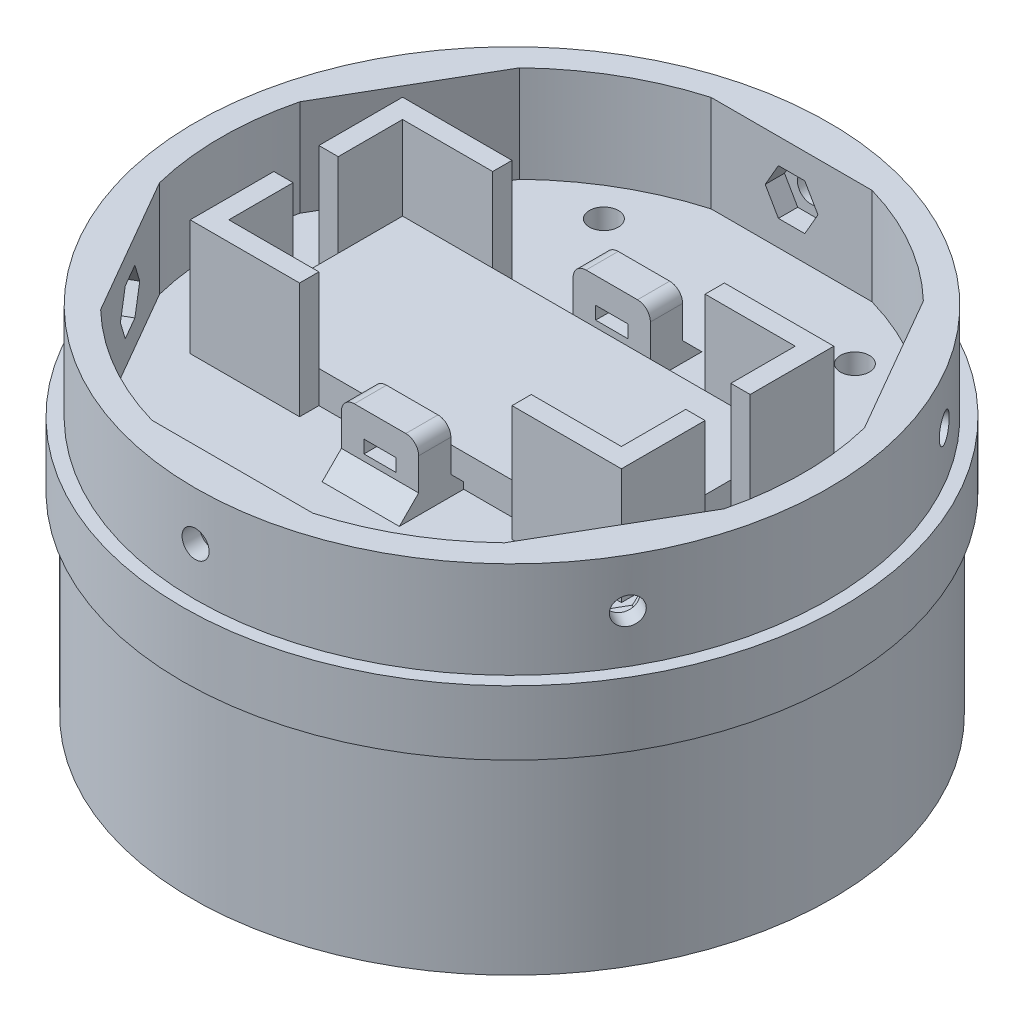
from build123d import *

# Parameters (mm, degrees)
SKETCH_5_R               = 49.2
EXTRUDE_3_DEPTH          = 15
SKETCH_9_R               = 2.25
CUT_EXTRUDE_3_DEPTH      = 56
EXTRUDE_4_DEPTH          = 18
SKETCH_4_W               = 61
SKETCH_4_H               = 27
EXTRUDE_5_DEPTH          = 5
SKETCH_11_W              = 12
SKETCH_11_H              = 5
EXTRUDE_6_DEPTH          = 10
FILLET_1_R               = 2
SKETCH_12_W              = 5
SKETCH_12_H              = 2
CUT_EXTRUDE_4_DEPTH      = 6
FILLET_1_OF_MIRROR_3_R   = 2
CHAMFER_5_SIZE           = 3
CUT_EXTRUDE_6_DEPTH      = 3
SKETCH_8_R               = 2.1
CUT_EXTRUDE_7_DEPTH      = 36
PATTERN_CIRCULAR_5_COUNT = 6
PATTERN_CIRCULAR_6_COUNT = 6
SKETCH_13_R              = 44.709478945
EXTRUDE_7_DEPTH          = 0.4
CHAMFER_6_SIZE           = 3


with BuildPart() as part:
    # Эскиз1 → Повернуть1 (revolve)
    with BuildSketch(Plane.XY, mode=Mode.PRIVATE) as revolve_1_sk:
        Polygon((44.7, 0), (49.7, 0), (49.7, 30), (51.2, 30), (51.2, 40), (0, 40), (0, 35), (44.7, 35), (44.7, 15), (32.7, 15), (32.7, 10), (44.7, 10), (44.7, 5), align=None)
    revolve(revolve_1_sk.sketch.rotate(Axis((0, 0, 0), (0, 1, 0)), 90), axis=Axis((0, 0, 0), (0, 1, 0)))

    # Эскиз5 → Бобышка-Вытянуть3 (add)
    with BuildSketch(Plane(origin=(0, 40, 0), x_dir=(1, 0, 0), z_dir=(0, 1, 0))):
        with Locations(Location((0, 0, 0), (0, 0, 270))):
            Circle(SKETCH_5_R)
        with BuildLine():
            ThreePointArc((-31.367715242, -32.543915568), (-22.6, -39.144348251), (-12.5, -43.437196042))
            Line((-12.5, -43.437196042), (12.5, -43.437196042))
            ThreePointArc((12.5, -43.437196042), (22.6, -39.144348251), (31.367715242, -32.543915568))
            Line((31.367715242, -32.543915568), (43.867715242, -10.893280474))
            ThreePointArc((43.867715242, -10.893280474), (45.2, 0), (43.867715242, 10.893280474))
            Line((43.867715242, 10.893280474), (31.367715242, 32.543915568))
            ThreePointArc((31.367715242, 32.543915568), (22.6, 39.144348251), (12.5, 43.437196042))
            Line((12.5, 43.437196042), (-12.5, 43.437196042))
            ThreePointArc((-12.5, 43.437196042), (-22.6, 39.144348251), (-31.367715242, 32.543915568))
            Line((-31.367715242, 32.543915568), (-43.867715242, 10.893280474))
            ThreePointArc((-43.867715242, 10.893280474), (-45.2, 0), (-43.867715242, -10.893280474))
            Line((-43.867715242, -10.893280474), (-31.367715242, -32.543915568))
        make_face(mode=Mode.SUBTRACT)
    extrude(amount=EXTRUDE_3_DEPTH)

    # Эскиз9 → Вырез-Вытянуть3 (cut)
    with BuildSketch(Plane.XZ):
        with Locations(Location((39, 0, 0), (0, 0, 270))):
            Circle(SKETCH_9_R)
    cut_extrude_3 = extrude(amount=-CUT_EXTRUDE_3_DEPTH, mode=Mode.SUBTRACT)

    # Эскиз10 → Бобышка-Вытянуть4 (add)
    with BuildSketch(Plane(origin=(0, 40, 0), x_dir=(1, 0, 0), z_dir=(0, 1, 0))):
        Polygon((30.5, -13.5), (30.5, -3.5), (33.5, -3.5), (33.5, -16.5), (16.5, -16.5), (16.5, -13.5), align=None)
        Polygon((-30.5, -13.5), (-16.5, -13.5), (-16.5, -16.5), (-33.5, -16.5), (-33.5, -3.5), (-30.5, -3.5), align=None)
        Polygon((-30.5, 13.5), (-16.5, 13.5), (-16.5, 16.5), (-33.5, 16.5), (-33.5, 3.5), (-30.5, 3.5), align=None)
        Polygon((16.5, 16.5), (16.5, 13.5), (30.5, 13.5), (30.5, 3.5), (33.5, 3.5), (33.5, 16.5), align=None)
    extrude(amount=EXTRUDE_4_DEPTH)

    # Эскиз4 → Бобышка-Вытянуть5 (add)
    with BuildSketch(Plane(origin=(0, 40, 0), x_dir=(1, 0, 0), z_dir=(0, 1, 0))):
        Rectangle(SKETCH_4_W, SKETCH_4_H)
    extrude(amount=EXTRUDE_5_DEPTH)

    # Эскиз11 → Бобышка-Вытянуть6 (add)
    with BuildSketch(Plane(origin=(0, 40, 0), x_dir=(1, 0, 0), z_dir=(0, 1, 0))):
        with Locations((0, 18)):
            Rectangle(SKETCH_11_W, SKETCH_11_H)
    extrude_6 = extrude(amount=EXTRUDE_6_DEPTH)

    # Скругление1
    fillet_1_edges = [part.edges().sort_by_distance(p)[0] for p in [
        (6, 50, -18),
        (-6, 50, -18),
    ]]
    fillet(fillet_1_edges, radius=FILLET_1_R)

    # Эскиз12 → Вырез-Вытянуть4 (cut)
    with BuildSketch(Plane(origin=(0, 0, -20.5), x_dir=(-1, 0, 0), z_dir=(0, 0, -1))):
        with Locations((0, 45)):
            Rectangle(SKETCH_12_W, SKETCH_12_H)
    cut_extrude_4 = extrude(amount=-CUT_EXTRUDE_4_DEPTH, mode=Mode.SUBTRACT)

    # Зеркальное отражение3: Бобышка-Вытянуть6, Вырез-Вытянуть4 across plane
    add(extrude_6.mirror(Plane.XY))
    add(cut_extrude_4.mirror(Plane.XY), mode=Mode.SUBTRACT)

    # Скругление1 of Зеркальное отражение3
    fillet_1_of_mirror_3_edges = [part.edges().sort_by_distance(p)[0] for p in [
        (6, 50, 18),
        (-6, 50, 18),
    ]]
    fillet(fillet_1_of_mirror_3_edges, radius=FILLET_1_OF_MIRROR_3_R)

    # Фаска5
    # the kernel refuses this chamfer: 3 mm, written as the material it adds along each edge
    with BuildSketch(Plane(origin=(-6, 40, -20.5), x_dir=(0, -0.027495876610584467, -0.9996219169112969), z_dir=(1, 0, 0)), Plane(origin=(6, 40, -15.5), x_dir=(0, -0.027495876610584485, 0.9996219169112969), z_dir=(-1, 0, 0)), Plane(origin=(-6, 40, 20.5), x_dir=(0, 0.9996219169112965, -0.02749587661058676), z_dir=(1, 0, 0))) as chamfer_5_piece_1:
        Polygon((CHAMFER_5_SIZE * 0.999621916911, CHAMFER_5_SIZE * 0.0274958766106), (-CHAMFER_5_SIZE * 0.0274958766106, CHAMFER_5_SIZE * 0.999621916911), (0, 0), align=None)
    extrude(amount=12)
    with BuildSketch(Plane(origin=(6, 40, 15.5), x_dir=(0, -0.027495876610584485, -0.9996219169112969), z_dir=(-1, 0, 0))) as chamfer_5_piece_2:
        Polygon((CHAMFER_5_SIZE * 0.999621916911, -CHAMFER_5_SIZE * 0.0274958766106), (-CHAMFER_5_SIZE * 0.0274958766106, -CHAMFER_5_SIZE * 0.999621916911), (0, 0), align=None)
    extrude(amount=12)

    # Эскиз6 → Вырез-Вытянуть6 (cut)
    with BuildSketch(Plane(origin=(-37.617715242, 0, -21.718598021), x_dir=(0.4999999999999999, 0, -0.8660254037844386), z_dir=(0.8660254037844387, 0, 0.49999999999999994))):
        Polygon((4.099186911, 47.5), (2.049593456, 51.05), (-2.049593456, 51.05), (-4.099186911, 47.5), (-2.049593456, 43.95), (2.049593456, 43.95), align=None)
    cut_extrude_6 = extrude(amount=-CUT_EXTRUDE_6_DEPTH, mode=Mode.SUBTRACT)

    # Эскиз8 → Вырез-Вытянуть7 (cut)
    with BuildSketch(Plane(origin=(-37.617715242, 0, -21.718598021), x_dir=(0.4999999999999999, 0, -0.8660254037844386), z_dir=(0.8660254037844387, 0, 0.49999999999999994))):
        with Locations((0, 47.5)):
            Circle(SKETCH_8_R)
    cut_extrude_7 = extrude(amount=-CUT_EXTRUDE_7_DEPTH, mode=Mode.SUBTRACT)

    # Круговой массив5: Вырез-Вытянуть6, Вырез-Вытянуть7 ×6 about axis
    pattern_circular_5_axis = Axis((0, 0, 0), (0, 1, 0))
    add([cut_extrude_6.rotate(pattern_circular_5_axis, i * 360 / PATTERN_CIRCULAR_5_COUNT) for i in range(1, PATTERN_CIRCULAR_5_COUNT)], mode=Mode.SUBTRACT)
    add([cut_extrude_7.rotate(pattern_circular_5_axis, i * 360 / PATTERN_CIRCULAR_5_COUNT) for i in range(1, PATTERN_CIRCULAR_5_COUNT)], mode=Mode.SUBTRACT)

    # Круговой массив6: Вырез-Вытянуть3 ×6 about axis
    pattern_circular_6_axis = Axis((0, 0, 0), (0, 1, 0))
    for i in range(1, PATTERN_CIRCULAR_6_COUNT):
        add(cut_extrude_3.rotate(pattern_circular_6_axis, i * 360 / PATTERN_CIRCULAR_6_COUNT), mode=Mode.SUBTRACT)

    # Эскиз13 → Бобышка-Вытянуть7 (add)
    with BuildSketch(Plane.XZ.offset(-35)):
        Circle(SKETCH_13_R)
    extrude(amount=-EXTRUDE_7_DEPTH)

    # Фаска6
    chamfer_6_edges = [part.edges().sort_by_distance(p)[0] for p in [
        (0, 35, 44.7),
        (0, 10, 44.7),
    ]]
    chamfer(chamfer_6_edges, length=CHAMFER_6_SIZE)


solid = part.part
